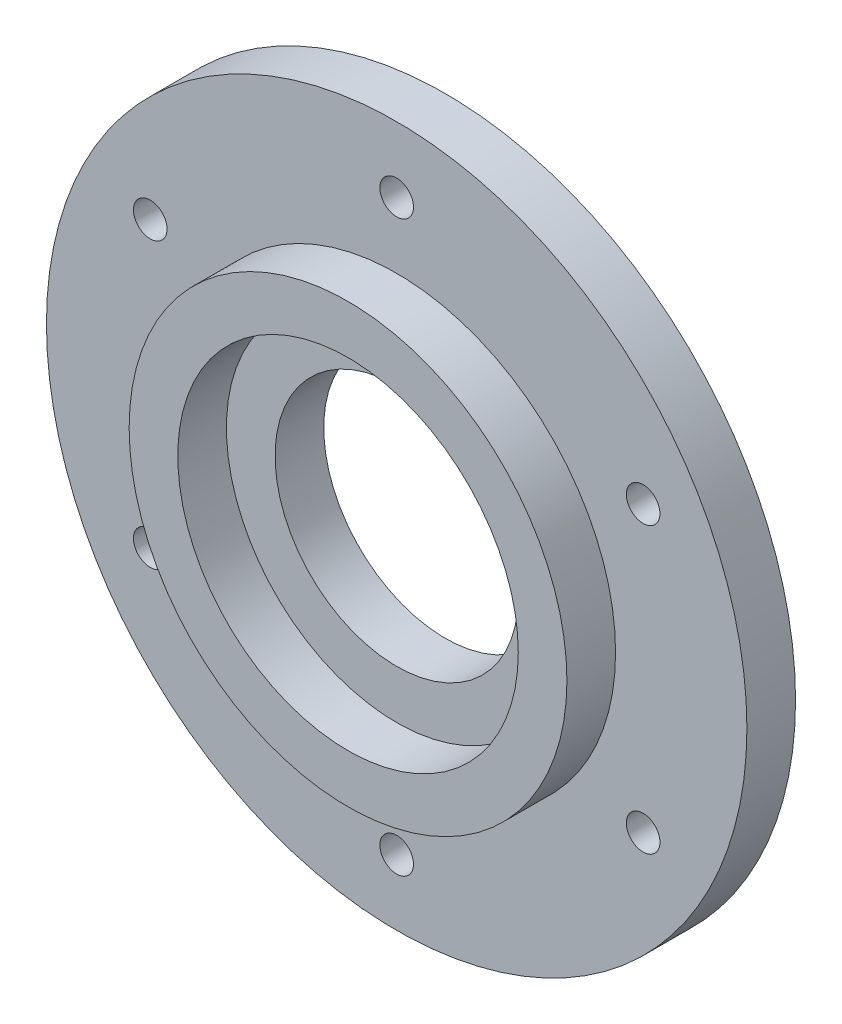
from build123d import *

# Parameters (mm, degrees)
SKETCH_CENTER_CUT_R                                 = 12.5
CUT_CENTER_DEPTH                                    = 52.15662225
CBORE_FOR_5_BINDING_HEAD_MACHINE_SCREW1_D           = 3.4544
CBORE_FOR_5_BINDING_HEAD_MACHINE_SCREW1_CBORE_D     = 7.54126
CBORE_FOR_5_BINDING_HEAD_MACHINE_SCREW1_CBORE_DEPTH = 1.9812
CIRPATTERN1_COUNT                                   = 6


with BuildPart() as part:
    # Sketch Spindle Skeleton → Main Revolve (revolve)
    with BuildSketch(Plane(origin=(0, 0, 0), x_dir=(0, 0, -1), z_dir=(1, 0, 0))):
        Polygon((-24.2, 17.5), (-24.2, 9.5), (-19.2, 9.5), (-19.2, 36), (-24.2, 36), (-24.2, 22.5), (-29.2, 22.5), (-29.2, 17.5), align=None)
    revolve(axis=Axis((0, 0, 1000), (0, 0, -1)))

    # Sketch Center Cut → Cut Center (cut, through all)
    with BuildSketch(Plane.XY.offset(24.2)):
        Circle(SKETCH_CENTER_CUT_R)
    extrude(amount=-CUT_CENTER_DEPTH, mode=Mode.SUBTRACT)

    # CBORE for #5 Binding Head Machine Screw1 (through all)
    with Locations(Plane(origin=(0, 0, 19.2), x_dir=(-1, 0, 0), z_dir=(0, 0, -1))):
        with Locations((0, 29.25)):
            cbore_for_5_binding_head_machine_screw1 = CounterBoreHole(CBORE_FOR_5_BINDING_HEAD_MACHINE_SCREW1_D / 2, CBORE_FOR_5_BINDING_HEAD_MACHINE_SCREW1_CBORE_D / 2, CBORE_FOR_5_BINDING_HEAD_MACHINE_SCREW1_CBORE_DEPTH)

    # CirPattern1: CBORE for #5 Binding Head Machine Screw1 ×6 about axis
    cirpattern1_axis = Axis((0, 0, 19.2), (0, 0, 1))
    for i in range(1, CIRPATTERN1_COUNT):
        add(cbore_for_5_binding_head_machine_screw1.rotate(cirpattern1_axis, i * 360 / CIRPATTERN1_COUNT), mode=Mode.SUBTRACT)


solid = part.part
